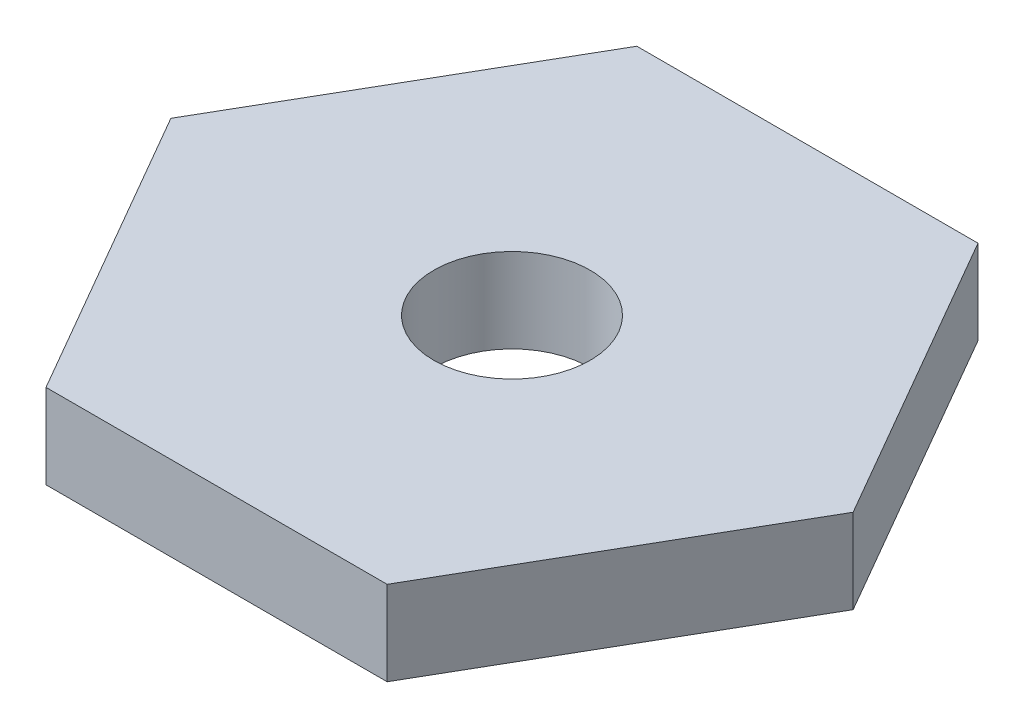
from build123d import *

# Parameters (mm, degrees)
ESQUISSE1_R        = 9.259370784
BOSS_EXTRU_1_DEPTH = 10


with BuildPart() as part:
    # Esquisse1 → Boss.-Extru.1 (new body)
    with BuildSketch(Plane(origin=(0, 0, 0), x_dir=(1, 0, 0), z_dir=(0, 1, 0))):
        Polygon((40.414518843, 0), (20.207259422, 35), (-20.207259422, 35), (-40.414518843, 0), (-20.207259422, -35), (20.207259422, -35), align=None)
        Circle(ESQUISSE1_R, mode=Mode.SUBTRACT)
    extrude(amount=BOSS_EXTRU_1_DEPTH)


solid = part.part
